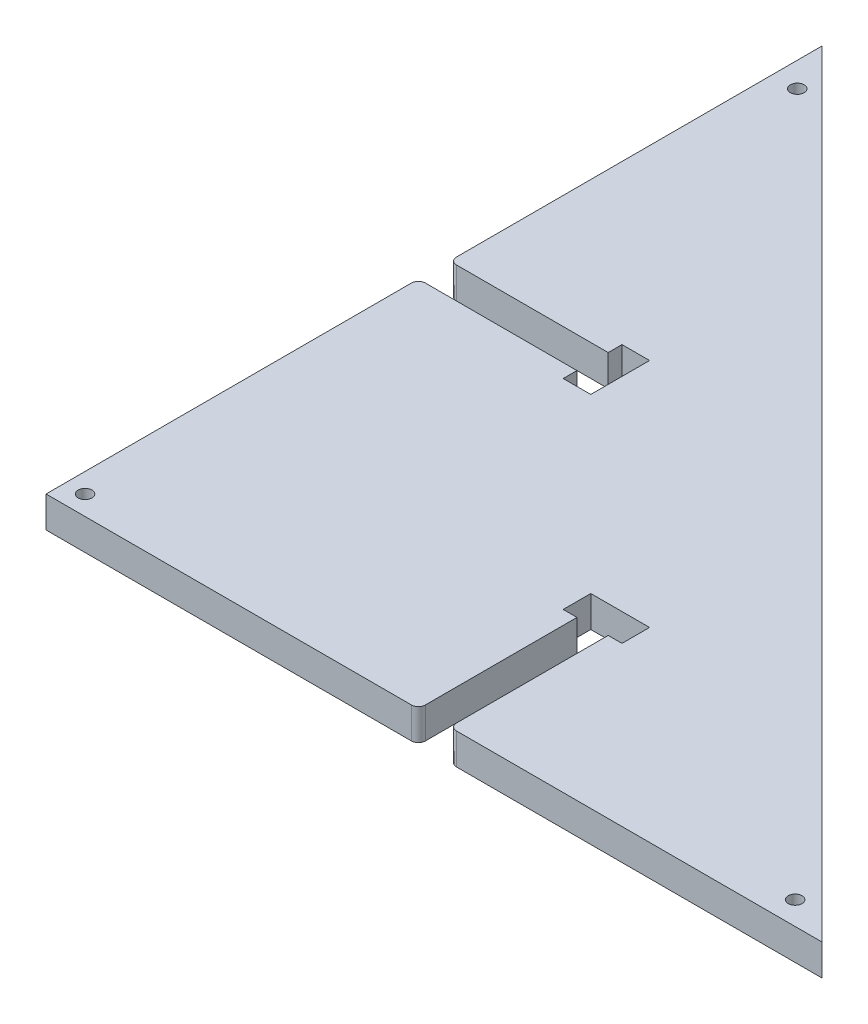
from build123d import *

# Parameters (mm, degrees)
SKETCH2_R           = 4
BOSS_EXTRUDE1_DEPTH = 18.1


with BuildPart() as part:
    # Sketch2 → Boss-Extrude1 (new body)
    with BuildSketch(Plane(origin=(0, 0, 0), x_dir=(1, 0, 0), z_dir=(0, 1, 0))):
        with BuildLine():
            Line((-31.397338403, 178.499429658), (-31.397338403, -33.450570342))
            Line((-31.397338403, -33.450570342), (180.552661597, -33.450570342))
            ThreePointArc((180.552661597, -33.450570342), (183.381088722, -32.278997467), (184.552661597, -29.450570342))
            Line((184.552661597, -29.450570342), (184.552661597, 58.524429658))
            Line((184.552661597, 58.524429658), (176.552661597, 58.524429658))
            Line((176.552661597, 58.524429658), (176.552661597, 74.524429658))
            Line((176.552661597, 74.524429658), (210.652661597, 74.524429658))
            Line((210.652661597, 74.524429658), (210.652661597, 58.524429658))
            Line((210.652661597, 58.524429658), (202.652661597, 58.524429658))
            Line((202.652661597, 58.524429658), (202.652661597, -29.450570342))
            ThreePointArc((202.652661597, -29.450570342), (203.824234472, -32.278997467), (206.652661597, -33.450570342))
            Line((206.652661597, -33.450570342), (418.602661597, -33.450570342))
            Line((418.602661597, -33.450570342), (-31.397338403, 416.549429658))
            Line((-31.397338403, 416.549429658), (-31.397338403, 204.599429658))
            ThreePointArc((-31.397338403, 204.599429658), (-30.225765528, 201.771002533), (-27.397338403, 200.599429658))
            Line((-27.397338403, 200.599429658), (60.577661597, 200.599429658))
            Line((60.577661597, 200.599429658), (60.577661597, 208.599429658))
            Line((60.577661597, 208.599429658), (76.577661597, 208.599429658))
            Line((76.577661597, 208.599429658), (76.577661597, 184.049429658))
            Line((76.577661597, 184.049429658), (76.577661597, 174.499429658))
            Line((76.577661597, 174.499429658), (60.577661597, 174.499429658))
            Line((60.577661597, 174.499429658), (60.577661597, 182.499429658))
            Line((60.577661597, 182.499429658), (-27.397338403, 182.499429658))
            ThreePointArc((-27.397338403, 182.499429658), (-30.225765528, 181.327856783), (-31.397338403, 178.499429658))
        make_face()
        with Locations((-20.083629904, -22.136861843)):
            Circle(SKETCH2_R, mode=Mode.SUBTRACT)
        with Locations((389.574293694, -19.983801728)):
            Circle(SKETCH2_R, mode=Mode.SUBTRACT)
        with Locations((-17.086503347, 387.927759546)):
            Circle(SKETCH2_R, mode=Mode.SUBTRACT)
    extrude(amount=BOSS_EXTRUDE1_DEPTH)


solid = part.part
